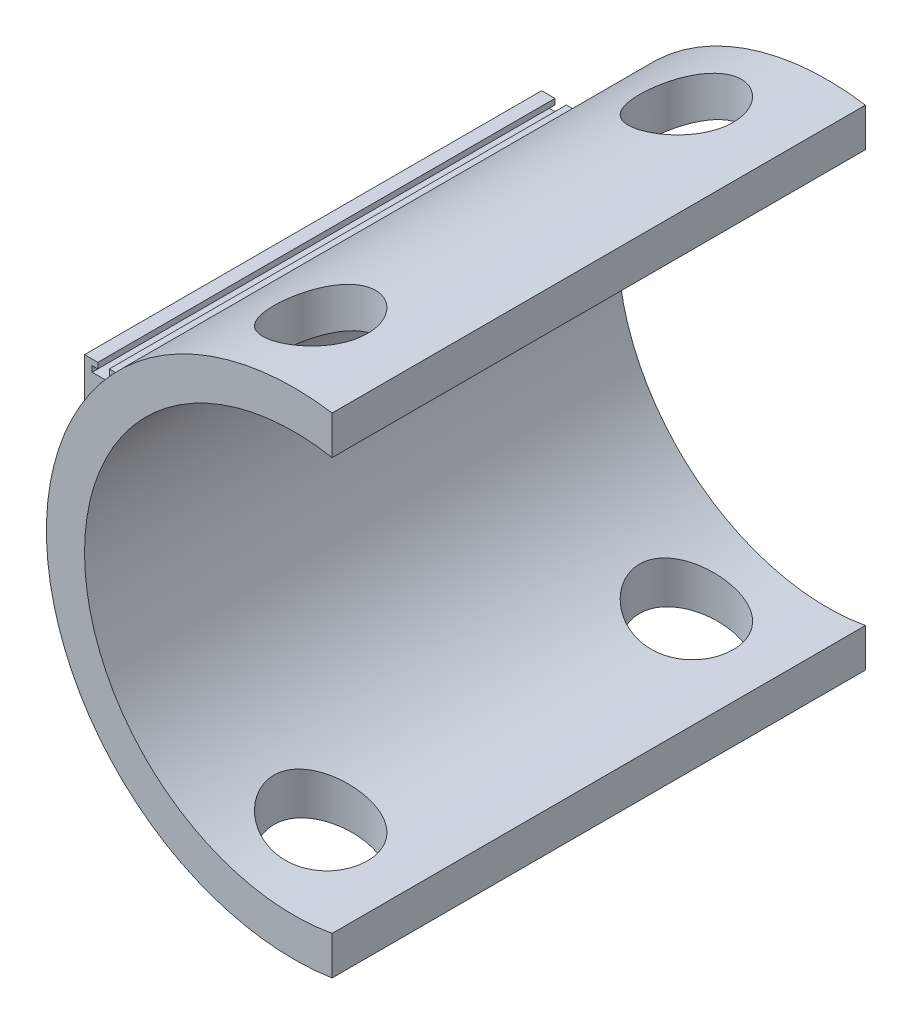
from build123d import *

# Parameters (mm, degrees)
ESQUISSE2_R                  = 65
ESQUISSE1_R                  = 65
ESQUISSE4_W                  = 168.541891076
ESQUISSE4_H                  = 143.597897644
ENL_V_MAT_EXTRU_2_DEPTH      = 172.61002318
COQUE2_T                     = -10
ESQUISSE5_R                  = 55
ENL_V_MAT_EXTRU_3_DEPTH      = 168.481342244
ENL_V_MAT_EXTRU_4_DEPTH      = 168.481342244
ENL_V_MAT_EXTRU_4_DEPTH_BACK = 168.481342244
ESQUISSE6_R                  = 12.294398433
BOSS_EXTRU_1_START           = 10
BOSS_EXTRU_1_DEPTH           = 120
ESQUISSE8_R                  = 2.5
ENL_V_MAT_EXTRU_5_DEPTH      = 8
ENL_V_MAT_EXTRU_8_DEPTH      = 160.216833444
ENL_V_MAT_EXTRU_8_DEPTH_BACK = 160.216833444


# Read off the part's stored shape, not the designer's step: Boss.-Extru.1
with BuildPart() as part:
    # Esquisse2 → Lissage2 section 0
    with BuildSketch(Plane(origin=(0, 0, 140), x_dir=(-1, 0, 0), z_dir=(0, 0, -1))):
        Circle(ESQUISSE2_R)
    # Esquisse1 → Lissage2 section 1
    with BuildSketch(Plane.XY):
        Circle(ESQUISSE1_R)
    loft()

    # Esquisse4 → Enlèv. mat.-Extru.2 (cut, through all)
    with BuildSketch(Plane(origin=(10, 0, 0), x_dir=(0, 0, -1), z_dir=(1, 0, 0))):
        with Locations((-79.475842773, 1.247725941)):
            Rectangle(ESQUISSE4_W, ESQUISSE4_H)
    extrude(amount=ENL_V_MAT_EXTRU_2_DEPTH, mode=Mode.SUBTRACT)

    # Coque2
    coque2_openings = [part.faces().sort_by_distance(p)[0] for p in [
        (10, 0, 70),
    ]]
    offset(amount=COQUE2_T, openings=coque2_openings)

    # Esquisse5 → Enlèv. mat.-Extru.3 (cut, through all)
    with BuildSketch(Plane.XY):
        Circle(ESQUISSE5_R)
    extrude(amount=ENL_V_MAT_EXTRU_3_DEPTH, mode=Mode.SUBTRACT)

    # Esquisse6 → Enlèv. mat.-Extru.4 (cut, two sides: drawn at the far end of the back side and taken through both)
    with BuildSketch(Plane(origin=(0, 0, 0), x_dir=(1, 0, 0), z_dir=(0, 1, 0)).offset(-ENL_V_MAT_EXTRU_4_DEPTH_BACK)):
        with Locations(Location((-15, -22, 0), (0, 0, 270))):
            Circle(ESQUISSE6_R)
        with Locations(Location((-15, -118, 0), (0, 0, 270))):
            Circle(ESQUISSE6_R)
    extrude(amount=ENL_V_MAT_EXTRU_4_DEPTH + ENL_V_MAT_EXTRU_4_DEPTH_BACK, mode=Mode.SUBTRACT)

    # Boss.-Extru.1 outline → Boss.-Extru.1 (add)
    with BuildSketch(Plane.XY.offset(BOSS_EXTRU_1_START)):
        with BuildLine():
            Line((-54.772255751, 35), (-65, 35))
            Line((-65, 35), (-65, 8.4e-08))
            ThreePointArc((-65, 8.4e-08), (-62.390690896, 18.231886616), (-54.772255751, 35))
        make_face()
        with BuildLine():
            ThreePointArc((-54.772255751, -35), (-62.390690919, -18.231886535), (-65, 8.4e-08))
            Line((-65, 8.4e-08), (-65, -35))
            Line((-65, -35), (-54.772255751, -35))
        make_face()
    extrude(amount=BOSS_EXTRU_1_DEPTH)

    # Esquisse8 → Enlèv. mat.-Extru.5 (cut)
    with BuildSketch(Plane.ZY.offset(65)):
        with Locations((22.844340416, 27.507468091)):
            Circle(ESQUISSE8_R)
        with Locations((117.155659584, 27.507468091)):
            Circle(ESQUISSE8_R)
        with Locations((117.155659584, -27.507468091)):
            Circle(ESQUISSE8_R)
        with Locations((22.844340416, -27.507468091)):
            Circle(ESQUISSE8_R)
    extrude(amount=-ENL_V_MAT_EXTRU_5_DEPTH, mode=Mode.SUBTRACT)

    # Esquisse12 → Enlèv. mat.-Extru.8 (cut, two sides: drawn at the far end of the back side and taken through both)
    with BuildSketch(Plane.XY.offset(130).offset(-ENL_V_MAT_EXTRU_8_DEPTH_BACK)):
        Polygon((-61.5, -35), (-58.5, -35), (-58.5, -33.5), (-57, -33.5), (-57, -32), (-63, -32), (-63, -33.5), (-61.5, -33.5), align=None)
        Polygon((-63, 32), (-63, 33.5), (-61.5, 33.5), (-61.5, 35), (-58.5, 35), (-58.5, 33.5), (-57, 33.5), (-57, 32), align=None)
    extrude(amount=ENL_V_MAT_EXTRU_8_DEPTH + ENL_V_MAT_EXTRU_8_DEPTH_BACK, mode=Mode.SUBTRACT)


solid = part.part
